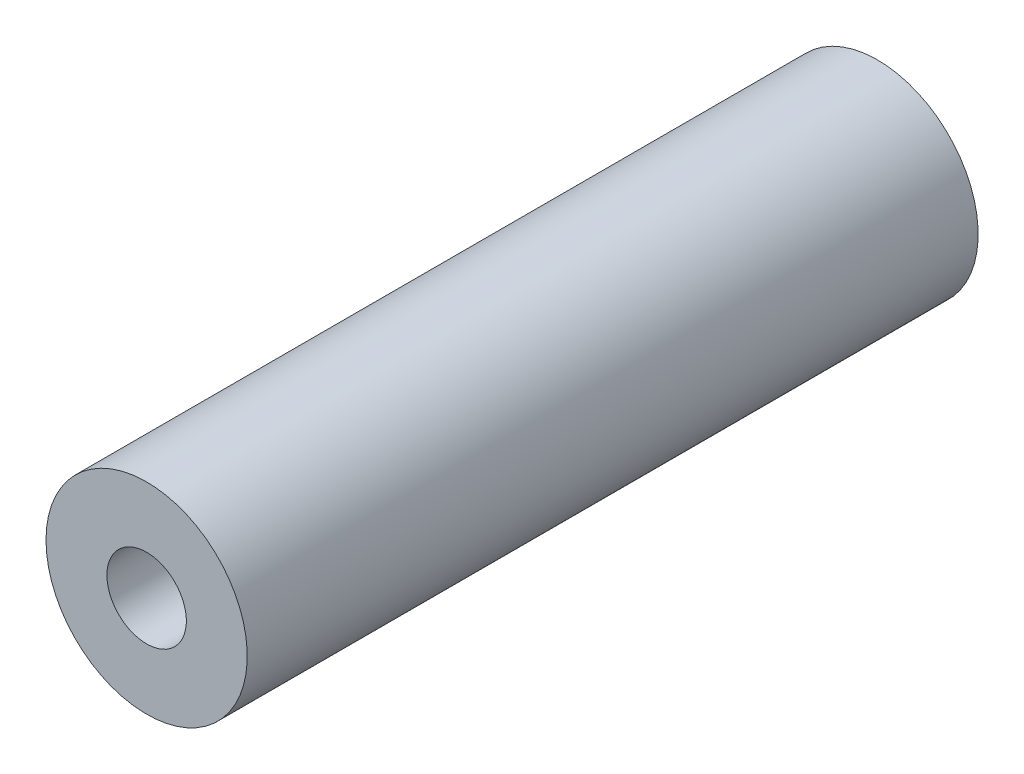
from build123d import *

# Parameters (mm, degrees)
SKETCH1_R           = 5.2451
SKETCH1_R_2         = 2.0701
BOSS_EXTRUDE1_DEPTH = 38.1


with BuildPart() as part:
    # Sketch1 → Boss-Extrude1 (new body)
    with BuildSketch(Plane.XY):
        Circle(SKETCH1_R)
        Circle(SKETCH1_R_2, mode=Mode.SUBTRACT)
    extrude(amount=BOSS_EXTRUDE1_DEPTH)


solid = part.part
